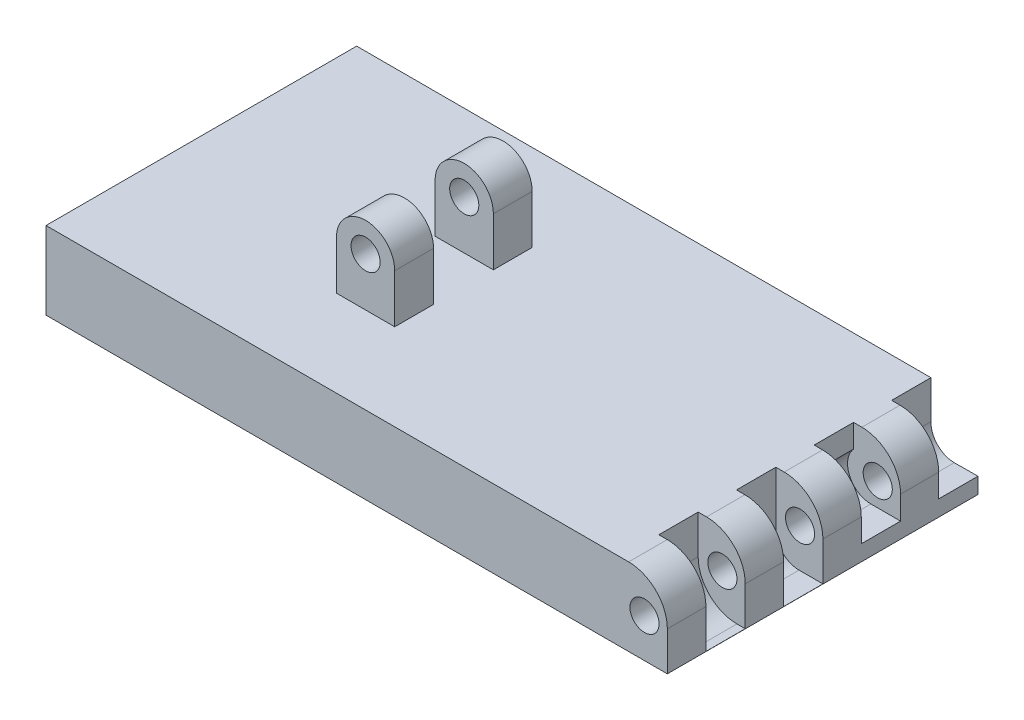
from build123d import *

# Parameters (mm, degrees)
BOSS_EXTRUDE1_DEPTH             = 50.8
SKETCH2_R                       = 2.38125
CUT_EXTRUDE1_DEPTH              = 50.8
CUT_EXTRUDE2_DEPTH              = 3.2131
CUT_EXTRUDE3_DEPTH              = 3.2131
CUT_EXTRUDE4_DEPTH              = 3.2131
CUT_EXTRUDE5_DEPTH              = 6.4262
SKETCH7_R                       = 2.38125
BOSS_EXTRUDE2_DEPTH             = 11.2395
SKETCH10_R                      = 2.38125
CUT_EXTRUDE6_DEPTH              = 4.8895
F_1_4_0_25_DIAMETER_HOLE1_D     = 6.35
F_1_4_0_25_DIAMETER_HOLE1_DEPTH = 9.525
F_1_4_0_25_DIAMETER_HOLE1_TIP   = 1.907732465
THREAD1_PITCH                   = 0.907142857
THREAD2_PITCH                   = 0.907142857
THREAD3_PITCH                   = 0.907142857
THREAD4_PITCH                   = 0.907142857


with BuildPart() as part:
    # Sketch1 → Boss-Extrude1 (new body)
    with BuildSketch(Plane.XY):
        with BuildLine():
            Line((0, 0), (95.2754, 0))
            ThreePointArc((95.2754, 0), (99.747567548, -1.852432452), (101.6, -6.3246))
            Line((101.6, -6.3246), (101.6, -12.7))
            Line((101.6, -12.7), (0, -12.7))
            Line((0, -12.7), (0, 0))
        make_face()
    extrude(amount=BOSS_EXTRUDE1_DEPTH)

    # Sketch2 → Cut-Extrude1 (cut)
    with BuildSketch(Plane.XY.offset(50.8)):
        with Locations((97.8662, -6.3246)):
            Circle(SKETCH2_R)
    extrude(amount=-CUT_EXTRUDE1_DEPTH, mode=Mode.SUBTRACT)

    # Sketch3 → Cut-Extrude2 (cut, symmetric)
    with BuildSketch(Plane.XY.offset(41.275)):
        with BuildLine():
            Line((101.6, -12.6746), (100.2411, -12.6746))
            ThreePointArc((100.2411, -12.6746), (95.759952196, -10.818447804), (93.9038, -6.3373))
            Line((93.9038, -6.3373), (93.9038, 0))
            Line((93.9038, 0), (95.2754, 0))
            Line((95.2754, 0), (101.6, 0))
            Line((101.6, 0), (101.6, -12.6746))
        make_face()
    extrude(amount=CUT_EXTRUDE2_DEPTH, both=True, mode=Mode.SUBTRACT)

    # Sketch4 → Cut-Extrude3 (cut, symmetric)
    with BuildSketch(Plane.XY.offset(28.575)):
        with BuildLine():
            Line((101.6, -12.6746), (97.701450721, -12.6746))
            ThreePointArc((97.701450721, -12.6746), (95.012333897, -11.558522515), (93.9038, -8.866287226))
            Line((93.9038, -8.866287226), (93.9038, 0))
            Line((93.9038, 0), (101.6, 0))
            Line((101.6, 0), (101.6, -12.6746))
        make_face()
    extrude(amount=CUT_EXTRUDE3_DEPTH, both=True, mode=Mode.SUBTRACT)

    # Sketch5 → Cut-Extrude4 (cut, symmetric)
    with BuildSketch(Plane.XY.offset(15.875)):
        with BuildLine():
            Line((101.6, -10.1346), (101.6, 0))
            Line((101.6, 0), (93.9038, 0))
            Line((93.9038, 0), (93.9038, -3.7846))
            ThreePointArc((93.9038, -3.7846), (93.265568091, -7.880025987), (96.743606331, -10.1346))
            Line((96.743606331, -10.1346), (101.6, -10.1346))
        make_face()
    extrude(amount=CUT_EXTRUDE4_DEPTH, both=True, mode=Mode.SUBTRACT)

    # Sketch6 → Cut-Extrude5 (cut)
    with BuildSketch(Plane.XY):
        with BuildLine():
            Line((97.712750691, -10.1346), (101.6, -10.103231822))
            Line((101.6, -10.103231822), (101.6, 0))
            Line((101.6, 0), (93.9038, 0))
            Line((93.9038, 0), (93.9038, -6.235187265))
            ThreePointArc((93.9038, -6.235187265), (94.987245002, -8.986876984), (97.712750691, -10.1346))
        make_face()
    extrude(amount=CUT_EXTRUDE5_DEPTH, mode=Mode.SUBTRACT)

    # Sketch7 → Boss-Extrude2 (add, symmetric)
    with BuildSketch(Plane(origin=(0, 0, 25.4), x_dir=(-1, 0, 0), z_dir=(0, 0, -1))):
        with BuildLine():
            Line((-42.8625, 0), (-42.8625, 7.9375))
            ThreePointArc((-42.8625, 7.9375), (-38.1, 12.7), (-33.3375, 7.9375))
            Line((-33.3375, 7.9375), (-33.3375, 0))
            Line((-33.3375, 0), (-42.8625, 0))
        make_face()
        with Locations((-38.1, 7.9375)):
            Circle(SKETCH7_R, mode=Mode.SUBTRACT)
    extrude(amount=BOSS_EXTRUDE2_DEPTH, both=True)

    # Sketch10 → Cut-Extrude6 (cut, symmetric)
    with BuildSketch(Plane(origin=(0, 0, 25.4), x_dir=(-1, 0, 0), z_dir=(0, 0, -1))):
        with BuildLine():
            Line((-42.8625, 7.9375), (-42.8625, 0))
            Line((-42.8625, 0), (-33.3375, 0))
            Line((-33.3375, 0), (-33.3375, 7.9375))
            ThreePointArc((-33.3375, 7.9375), (-38.1, 12.7), (-42.8625, 7.9375))
        make_face()
        with Locations((-38.1, 7.9375)):
            Circle(SKETCH10_R, mode=Mode.SUBTRACT)
    extrude(amount=CUT_EXTRUDE6_DEPTH, both=True, mode=Mode.SUBTRACT)

    # 1/4 (0.25) Diameter Hole1
    with Locations(Plane(origin=(0, -12.7, 0), x_dir=(-1, 0, 0), z_dir=(0, -1, 0))):
        with Locations((-88.9, -12.666661607), (-88.9, -38.066663393), (-12.7, -38.095238393), (-12.7, -12.695236607)):
            Hole(F_1_4_0_25_DIAMETER_HOLE1_D / 2, depth=F_1_4_0_25_DIAMETER_HOLE1_DEPTH)
            with Locations((0, 0, -(F_1_4_0_25_DIAMETER_HOLE1_DEPTH + F_1_4_0_25_DIAMETER_HOLE1_TIP / 2))):  # 118° drill point
                Cone(0, F_1_4_0_25_DIAMETER_HOLE1_D / 2, F_1_4_0_25_DIAMETER_HOLE1_TIP, mode=Mode.SUBTRACT)

    # Thread1: the profile of Thread Profile1 profile screwed along a right-hand helix of 10 turns, 8 arcs to a turn; built about Z, then put on its axis
    thread1_z = Axis((0, 0, 0), (0, 0, 1))
    thread1_corners = [(3.1753, 0, -0.000173205), (3.1753, 0, 0.793923203), (2.683994528, 0, 0.510267856), (2.683994528, 0, 0.283482142)]
    with BuildLine(mode=Mode.PRIVATE) as thread1_profile:
        Line(thread1_corners[0], thread1_corners[1])
        Line(thread1_corners[1], thread1_corners[2])
        Line(thread1_corners[2], thread1_corners[3])
        Line(thread1_corners[3], thread1_corners[0])
    thread1_cap = Face(thread1_profile.wire())
    thread1_turn_angles = [0, 22.5, 45, 67.5, 90, 112.5, 135, 157.5, 180, 202.5, 225, 247.5, 270, 292.5, 315, 337.5, 360]
    thread1_turn_weights = [1, 0.9238795325112867, 1, 0.9238795325112867, 1, 0.9238795325112867, 1, 0.9238795325112867, 1, 0.9238795325112867, 1, 0.9238795325112867, 1, 0.9238795325112867, 1, 0.9238795325112867, 1]
    thread1_turn_rails = [Edge.make_bspline([Vector(p[0], p[1], 0).rotate(thread1_z, thread1_turn_angles[k]) / thread1_turn_weights[k] + Vector(0, 0, p[2] + THREAD1_PITCH * thread1_turn_angles[k] / 360) for k in range(17)], [0, 0, 0, 1, 1, 2, 2, 3, 3, 4, 4, 5, 5, 6, 6, 7, 7, 8, 8, 8], 2, thread1_turn_weights) for p in thread1_corners]
    thread1_turn_sides = [Face.make_surface_from_curves(thread1_turn_rails[p[0]], thread1_turn_rails[p[1]]) for p in [(0, 1), (1, 2), (2, 3), (3, 0)]]
    thread1 = Plane(origin=(88.9, -12.7, 12.666661607), x_dir=(1, 0, 0), z_dir=(0, 1, 0)) * Solid(Shell([*[p.moved(Location((0, 0, THREAD1_PITCH * i))) for i in range(10) for p in thread1_turn_sides], thread1_cap, thread1_cap.rotate(thread1_z, 3600).moved(Location((0, 0, THREAD1_PITCH * 3600 / 360)))]))
    add(thread1)

    # Thread2: the profile of Thread Profile2 profile screwed along a right-hand helix of 10 turns, 8 arcs to a turn; built about Z, then put on its axis
    thread2_z = Axis((0, 0, 0), (0, 0, 1))
    thread2_corners = [(3.1753, 0, -0.000173205), (3.1753, 0, 0.793923203), (2.683994528, 0, 0.510267856), (2.683994528, 0, 0.283482142)]
    with BuildLine(mode=Mode.PRIVATE) as thread2_profile:
        Line(thread2_corners[0], thread2_corners[1])
        Line(thread2_corners[1], thread2_corners[2])
        Line(thread2_corners[2], thread2_corners[3])
        Line(thread2_corners[3], thread2_corners[0])
    thread2_cap = Face(thread2_profile.wire())
    thread2_turn_angles = [0, 22.5, 45, 67.5, 90, 112.5, 135, 157.5, 180, 202.5, 225, 247.5, 270, 292.5, 315, 337.5, 360]
    thread2_turn_weights = [1, 0.9238795325112867, 1, 0.9238795325112867, 1, 0.9238795325112867, 1, 0.9238795325112867, 1, 0.9238795325112867, 1, 0.9238795325112867, 1, 0.9238795325112867, 1, 0.9238795325112867, 1]
    thread2_turn_rails = [Edge.make_bspline([Vector(p[0], p[1], 0).rotate(thread2_z, thread2_turn_angles[k]) / thread2_turn_weights[k] + Vector(0, 0, p[2] + THREAD2_PITCH * thread2_turn_angles[k] / 360) for k in range(17)], [0, 0, 0, 1, 1, 2, 2, 3, 3, 4, 4, 5, 5, 6, 6, 7, 7, 8, 8, 8], 2, thread2_turn_weights) for p in thread2_corners]
    thread2_turn_sides = [Face.make_surface_from_curves(thread2_turn_rails[p[0]], thread2_turn_rails[p[1]]) for p in [(0, 1), (1, 2), (2, 3), (3, 0)]]
    thread2 = Plane(origin=(88.9, -12.7, 38.066663393), x_dir=(1, 0, 0), z_dir=(0, 1, 0)) * Solid(Shell([*[p.moved(Location((0, 0, THREAD2_PITCH * i))) for i in range(10) for p in thread2_turn_sides], thread2_cap, thread2_cap.rotate(thread2_z, 3600).moved(Location((0, 0, THREAD2_PITCH * 3600 / 360)))]))
    add(thread2)

    # Thread3: the profile of Thread Profile3 profile screwed along a right-hand helix of 10 turns, 8 arcs to a turn; built about Z, then put on its axis
    thread3_z = Axis((0, 0, 0), (0, 0, 1))
    thread3_corners = [(3.1753, 0, -0.000173205), (3.1753, 0, 0.793923203), (2.683994528, 0, 0.510267856), (2.683994528, 0, 0.283482142)]
    with BuildLine(mode=Mode.PRIVATE) as thread3_profile:
        Line(thread3_corners[0], thread3_corners[1])
        Line(thread3_corners[1], thread3_corners[2])
        Line(thread3_corners[2], thread3_corners[3])
        Line(thread3_corners[3], thread3_corners[0])
    thread3_cap = Face(thread3_profile.wire())
    thread3_turn_angles = [0, 22.5, 45, 67.5, 90, 112.5, 135, 157.5, 180, 202.5, 225, 247.5, 270, 292.5, 315, 337.5, 360]
    thread3_turn_weights = [1, 0.9238795325112867, 1, 0.9238795325112867, 1, 0.9238795325112867, 1, 0.9238795325112867, 1, 0.9238795325112867, 1, 0.9238795325112867, 1, 0.9238795325112867, 1, 0.9238795325112867, 1]
    thread3_turn_rails = [Edge.make_bspline([Vector(p[0], p[1], 0).rotate(thread3_z, thread3_turn_angles[k]) / thread3_turn_weights[k] + Vector(0, 0, p[2] + THREAD3_PITCH * thread3_turn_angles[k] / 360) for k in range(17)], [0, 0, 0, 1, 1, 2, 2, 3, 3, 4, 4, 5, 5, 6, 6, 7, 7, 8, 8, 8], 2, thread3_turn_weights) for p in thread3_corners]
    thread3_turn_sides = [Face.make_surface_from_curves(thread3_turn_rails[p[0]], thread3_turn_rails[p[1]]) for p in [(0, 1), (1, 2), (2, 3), (3, 0)]]
    thread3 = Plane(origin=(12.7, -12.7, 12.695236607), x_dir=(1, 0, 0), z_dir=(0, 1, 0)) * Solid(Shell([*[p.moved(Location((0, 0, THREAD3_PITCH * i))) for i in range(10) for p in thread3_turn_sides], thread3_cap, thread3_cap.rotate(thread3_z, 3600).moved(Location((0, 0, THREAD3_PITCH * 3600 / 360)))]))
    add(thread3)

    # Thread4: the profile of Thread Profile4 profile screwed along a right-hand helix of 10 turns, 8 arcs to a turn; built about Z, then put on its axis
    thread4_z = Axis((0, 0, 0), (0, 0, 1))
    thread4_corners = [(3.1753, 0, -0.000173205), (3.1753, 0, 0.793923203), (2.683994528, 0, 0.510267856), (2.683994528, 0, 0.283482142)]
    with BuildLine(mode=Mode.PRIVATE) as thread4_profile:
        Line(thread4_corners[0], thread4_corners[1])
        Line(thread4_corners[1], thread4_corners[2])
        Line(thread4_corners[2], thread4_corners[3])
        Line(thread4_corners[3], thread4_corners[0])
    thread4_cap = Face(thread4_profile.wire())
    thread4_turn_angles = [0, 22.5, 45, 67.5, 90, 112.5, 135, 157.5, 180, 202.5, 225, 247.5, 270, 292.5, 315, 337.5, 360]
    thread4_turn_weights = [1, 0.9238795325112867, 1, 0.9238795325112867, 1, 0.9238795325112867, 1, 0.9238795325112867, 1, 0.9238795325112867, 1, 0.9238795325112867, 1, 0.9238795325112867, 1, 0.9238795325112867, 1]
    thread4_turn_rails = [Edge.make_bspline([Vector(p[0], p[1], 0).rotate(thread4_z, thread4_turn_angles[k]) / thread4_turn_weights[k] + Vector(0, 0, p[2] + THREAD4_PITCH * thread4_turn_angles[k] / 360) for k in range(17)], [0, 0, 0, 1, 1, 2, 2, 3, 3, 4, 4, 5, 5, 6, 6, 7, 7, 8, 8, 8], 2, thread4_turn_weights) for p in thread4_corners]
    thread4_turn_sides = [Face.make_surface_from_curves(thread4_turn_rails[p[0]], thread4_turn_rails[p[1]]) for p in [(0, 1), (1, 2), (2, 3), (3, 0)]]
    thread4 = Plane(origin=(12.7, -12.7, 38.095238393), x_dir=(1, 0, 0), z_dir=(0, 1, 0)) * Solid(Shell([*[p.moved(Location((0, 0, THREAD4_PITCH * i))) for i in range(10) for p in thread4_turn_sides], thread4_cap, thread4_cap.rotate(thread4_z, 3600).moved(Location((0, 0, THREAD4_PITCH * 3600 / 360)))]))
    add(thread4)


solid = part.part
